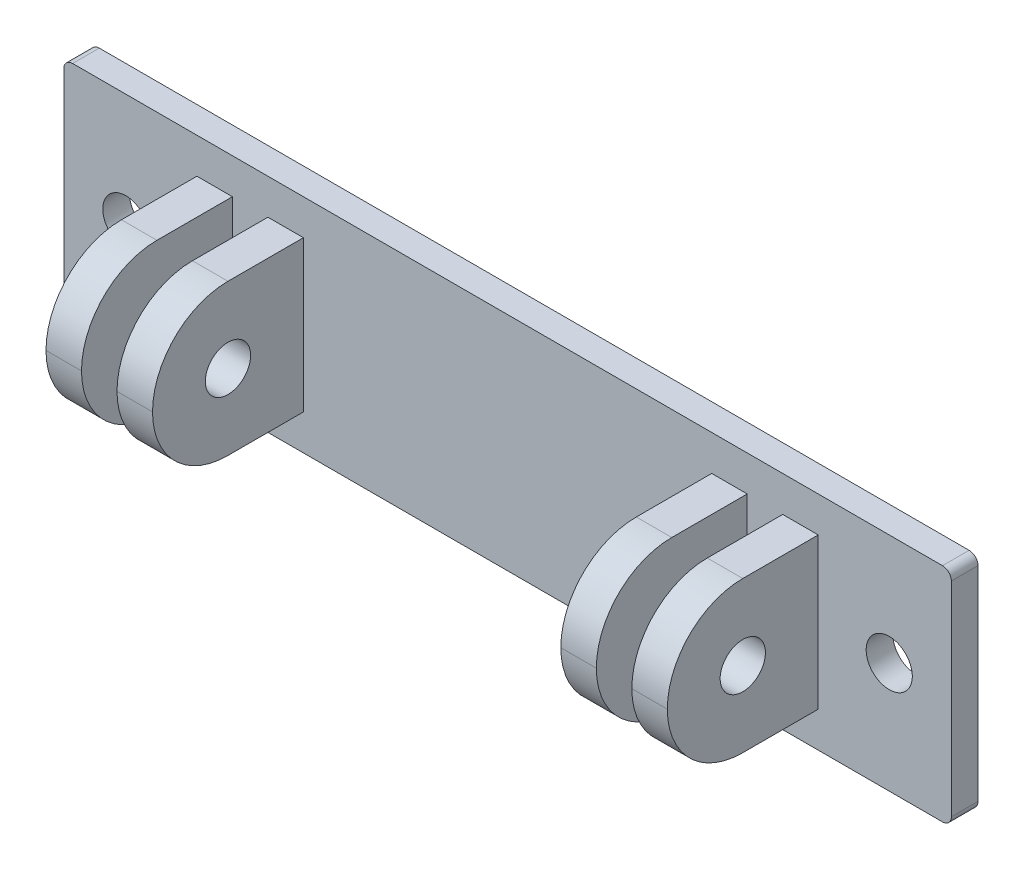
from build123d import *

# Parameters (mm, degrees)
SKIZZE1_W                            = 100
SKIZZE1_H                            = 25
AUFSATZ_LINEAR_AUSTRAGEN1_DEPTH      = 3
SKIZZE3_W                            = 4
SKIZZE3_H                            = 17
AUFSATZ_LINEAR_AUSTRAGEN2_DEPTH      = 17
SCHNITT_LINEAR_AUSTRAGEN1_DEPTH      = 78.95222289
SCHNITT_LINEAR_AUSTRAGEN1_DEPTH_BACK = 78.95222289
SKIZZE5_R                            = 2.55
VERRUNDUNG1_R                        = 8.5
SKIZZE6_R                            = 2.6
SCHNITT_LINEAR_AUSTRAGEN2_DEPTH      = 3
VERRUNDUNG2_R                        = 1


with BuildPart() as part:
    # Skizze1 → Aufsatz-Linear austragen1 (new body)
    with BuildSketch(Plane.XY):
        with Locations((45.947748482, 6.142667555)):
            Rectangle(SKIZZE1_W, SKIZZE1_H)
    extrude(amount=AUFSATZ_LINEAR_AUSTRAGEN1_DEPTH)

    # Skizze3 → Aufsatz-Linear austragen2 (add)
    with BuildSketch(Plane.XY.offset(3)):
        with Locations((12.947748482, 6.142667555)):
            Rectangle(SKIZZE3_W, SKIZZE3_H)
        with Locations((20.947748482, 6.142667555)):
            Rectangle(SKIZZE3_W, SKIZZE3_H)
        with Locations((78.947748482, 6.142667555)):
            Rectangle(SKIZZE3_W, SKIZZE3_H)
        with Locations((70.947748482, 6.142667555)):
            Rectangle(SKIZZE3_W, SKIZZE3_H)
    extrude(amount=AUFSATZ_LINEAR_AUSTRAGEN2_DEPTH)

    # Skizze5 → Schnitt-Linear austragen1 (cut, two sides: drawn at the far end of the back side and taken through both)
    with BuildSketch(Plane(origin=(22.947748482, 0, 0), x_dir=(0, 0, -1), z_dir=(1, 0, 0)).offset(-SCHNITT_LINEAR_AUSTRAGEN1_DEPTH_BACK)):
        with Locations(Location((-11.5, 6.142667555, 0), (0, 0, 90))):
            Circle(SKIZZE5_R)
    extrude(amount=SCHNITT_LINEAR_AUSTRAGEN1_DEPTH + SCHNITT_LINEAR_AUSTRAGEN1_DEPTH_BACK, mode=Mode.SUBTRACT)

    # Verrundung1
    verrundung1_edges = [part.edges().sort_by_distance(p)[0] for p in [
        (20.947748482, 14.642667555, 20),
        (12.947748482, 14.642667555, 20),
        (12.947748482, -2.357332445, 20),
        (20.947748482, -2.357332445, 20),
        (78.947748482, 14.642667555, 20),
        (70.947748482, 14.642667555, 20),
        (70.947748482, -2.357332445, 20),
        (78.947748482, -2.357332445, 20),
    ]]
    fillet(verrundung1_edges, radius=VERRUNDUNG1_R - 0.0001)  # a hair under: the kernel refuses the full size

    # Skizze6 → Schnitt-Linear austragen2 (cut)
    with BuildSketch(Plane.XY.offset(3)):
        with Locations((2.947748482, 6.142667555)):
            Circle(SKIZZE6_R)
        with Locations(Location((88.947748482, 6.142667555, 0), (0, 0, 180))):
            Circle(SKIZZE6_R)
    extrude(amount=-SCHNITT_LINEAR_AUSTRAGEN2_DEPTH, mode=Mode.SUBTRACT)

    # Verrundung2
    verrundung2_edges = [part.edges().sort_by_distance(p)[0] for p in [
        (95.947748482, -6.357332445, 1.5),
        (95.947748482, 18.642667555, 1.5),
        (-4.052251518, 18.642667555, 1.5),
        (-4.052251518, -6.357332445, 1.5),
    ]]
    fillet(verrundung2_edges, radius=VERRUNDUNG2_R)


solid = part.part
